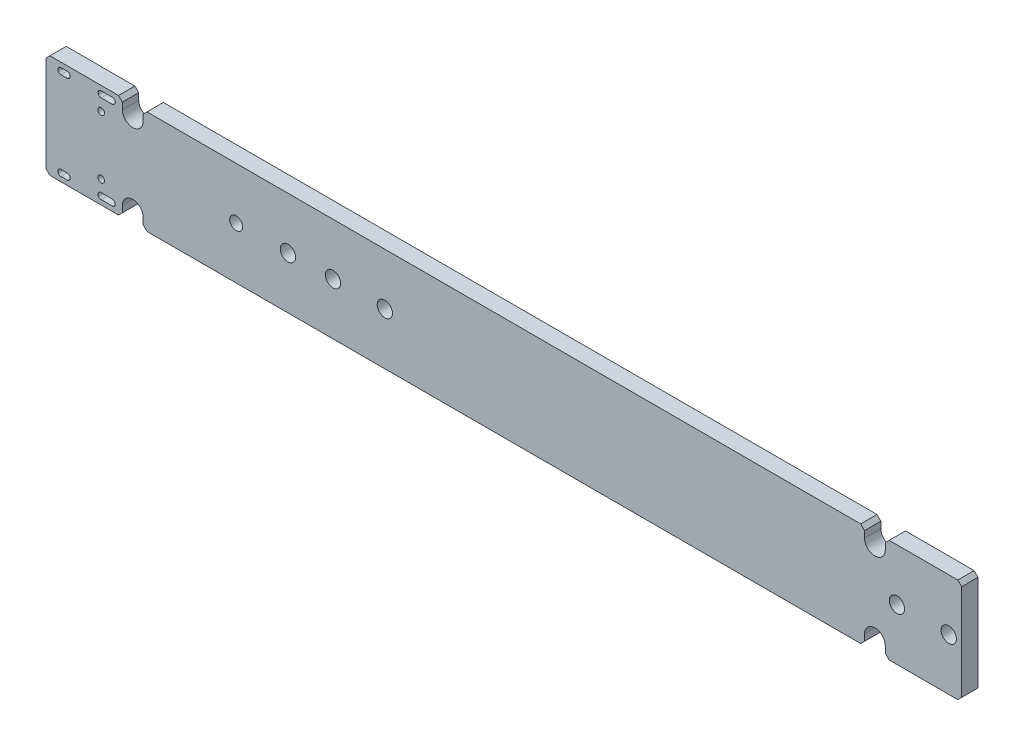
from build123d import *

# Parameters (mm, degrees)
EXTRUDE_1_OUTLINE_R = 0.325
EXTRUDE_1_DEPTH     = 1.6
SKETCH_1_R          = 0.635
SKETCH_1_R_2        = 0.750616105
CUT_EXTRUDE_1_DEPTH = 92.214625368


# Read off the part's stored shape, not the designer's step: 凸台-拉伸1
with BuildPart() as part:
    # 凸台-拉伸1 outline → 凸台-拉伸1 (new body)
    with BuildSketch(Plane.XY):
        with BuildLine():
            Line((81.153, -5.08), (81.534, -4.699))
            Line((81.534, -4.699), (81.534, -4.064))
            ThreePointArc((81.534, -4.064), (82.55, -3.048), (83.566, -4.064))
            Line((83.566, -4.064), (83.566, -4.699))
            Line((83.566, -4.699), (83.947, -5.08))
            Line((83.947, -5.08), (90.678, -5.08))
            Line((90.678, -5.08), (91.059, -4.699))
            Line((91.059, -4.699), (91.059, 0))
            Line((91.059, 0), (1.27, 0))
            Line((1.27, 0), (1.27, -4.699))
            Line((1.27, -4.699), (1.651, -5.08))
            Line((1.651, -5.08), (8.382, -5.08))
            Line((8.382, -5.08), (8.763, -4.699))
            Line((8.763, -4.699), (8.763, -4.064))
            ThreePointArc((8.763, -4.064), (9.779, -3.048), (10.795, -4.064))
            Line((10.795, -4.064), (10.795, -4.699))
            Line((10.795, -4.699), (11.176, -5.08))
            Line((11.176, -5.08), (81.153, -5.08))
        make_face()
        with BuildLine():
            Line((2.728, -4.02), (3.348, -4.02))
            ThreePointArc((3.348, -4.02), (3.648, -4.32), (3.348, -4.62))
            Line((3.348, -4.62), (2.728, -4.62))
            ThreePointArc((2.728, -4.62), (2.428, -4.32), (2.728, -4.02))
        make_face(mode=Mode.SUBTRACT)
        with BuildLine():
            Line((7.763, -4.62), (6.663, -4.62))
            ThreePointArc((6.663, -4.62), (6.363, -4.32), (6.663, -4.02))
            Line((6.663, -4.02), (7.763, -4.02))
            ThreePointArc((7.763, -4.02), (8.063, -4.32), (7.763, -4.62))
        make_face(mode=Mode.SUBTRACT)
        with Locations((6.683, -2.8687)):
            Circle(EXTRUDE_1_OUTLINE_R, mode=Mode.SUBTRACT)
    extrude_1 = extrude(amount=EXTRUDE_1_DEPTH)

    # 镜向1: 凸台-拉伸1 across plane
    add(extrude_1.mirror(Plane(origin=(0, 0, 1.6), x_dir=(0, 0, 1), z_dir=(0, 1, 0))))

    # 草图1 → 切除-拉伸1 (cut, through all)
    with BuildSketch(Plane.XY):
        with Locations((19.914, 0)):
            Circle(SKETCH_1_R)
        with Locations((24.994, 0)):
            Circle(SKETCH_1_R_2)
        with Locations((29.414, 0)):
            Circle(SKETCH_1_R_2)
        with Locations((34.494, 0)):
            Circle(SKETCH_1_R_2)
        with Locations((89.789, 0)):
            Circle(SKETCH_1_R_2)
        with Locations((84.709, 0)):
            Circle(SKETCH_1_R_2)
    extrude(amount=CUT_EXTRUDE_1_DEPTH, mode=Mode.SUBTRACT)


solid = part.part
